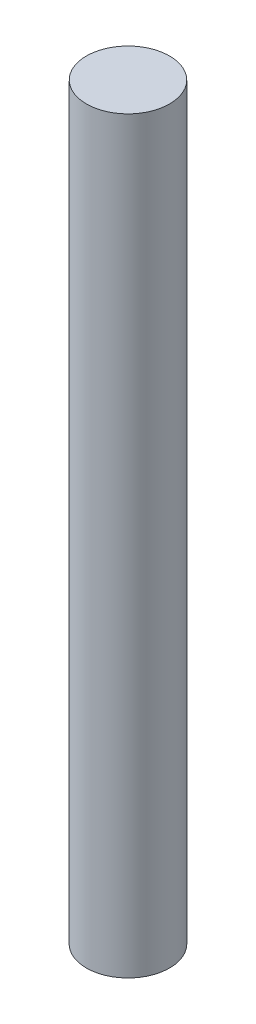
from build123d import *

# Parameters (mm, degrees)
SKETCH2_R           = 3.175
BOSS_EXTRUDE1_DEPTH = 28.575


with BuildPart() as part:
    # Sketch2 → Boss-Extrude1 (new, symmetric)
    with BuildSketch(Plane(origin=(0, 0, 0), x_dir=(1, 0, 0), z_dir=(0, 1, 0))):
        Circle(SKETCH2_R)
    extrude(amount=BOSS_EXTRUDE1_DEPTH, both=True)


solid = part.part
